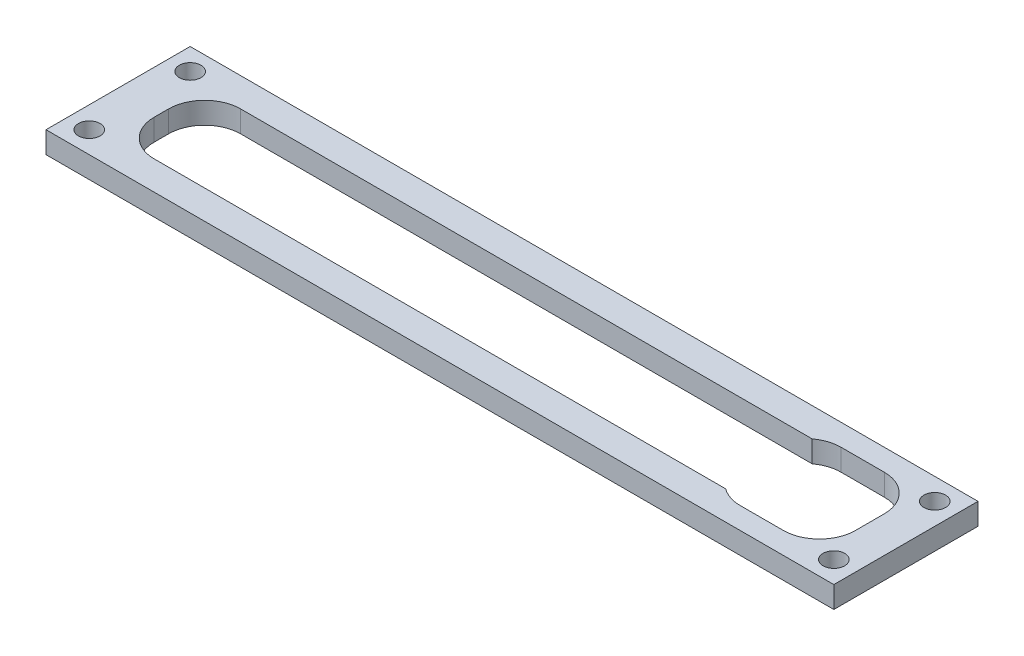
from build123d import *

# Parameters (mm, degrees)
SKETCH1_W           = 109.295835398
SKETCH1_H           = 20
SKETCH1_R           = 1.5
SKETCH1_W_2         = 97.295835398
SKETCH1_H_2         = 12
BOSS_EXTRUDE1_DEPTH = 3
CUT_EXTRUDE1_DEPTH  = 112.151156699
FILLET1_R           = 5


with BuildPart() as part:
    # Sketch1 → Boss-Extrude1 (new body)
    with BuildSketch(Plane(origin=(0, 0, 0), x_dir=(1, 0, 0), z_dir=(0, 1, 0))):
        with Locations((54.647917699, 10)):
            Rectangle(SKETCH1_W, SKETCH1_H)
        with Locations(Location((3, 17, 0), (0, 0, 270))):
            Circle(SKETCH1_R, mode=Mode.SUBTRACT)
        with Locations(Location((3, 3, 0), (0, 0, 90))):
            Circle(SKETCH1_R, mode=Mode.SUBTRACT)
        with Locations(Location((106.295835398, 3, 0), (0, 0, 270))):
            Circle(SKETCH1_R, mode=Mode.SUBTRACT)
        with Locations(Location((106.295835398, 17, 0), (0, 0, 90))):
            Circle(SKETCH1_R, mode=Mode.SUBTRACT)
        with Locations((54.647917699, 10)):
            Rectangle(SKETCH1_W_2, SKETCH1_H_2, mode=Mode.SUBTRACT)
    extrude(amount=BOSS_EXTRUDE1_DEPTH)

    # Sketch2 → Cut-Extrude1 (cut, through all)
    with BuildSketch(Plane(origin=(0, 3, 0), x_dir=(1, 0, 0), z_dir=(0, 1, 0))):
        Polygon((90.295835398, 17), (90.295835398, 16), (103.295835398, 16), (103.295835398, 4), (90.295835398, 4), (90.295835398, 3), (104.295835398, 3), (104.295835398, 17), align=None)
    extrude(amount=-CUT_EXTRUDE1_DEPTH, mode=Mode.SUBTRACT)

    # Fillet1
    # the kernel refuses this fillet: 5 mm, written as the material it adds along each edge
    with BuildSketch(Plane(origin=(104.295835398, 3, -17), x_dir=(0, 0, 1), z_dir=(0, -1, 0)), Plane(origin=(104.295835398, 3, -3), x_dir=(-1, 0, 0), z_dir=(0, -1, 0)), Plane(origin=(6, 0, -16), x_dir=(0, 0, 1), z_dir=(0, 1, 0))) as fillet1_piece_1:
        with BuildLine():
            CenterArc((FILLET1_R, FILLET1_R), FILLET1_R, 180, 90)
            Line((0, FILLET1_R), (-FILLET1_R * 0.02, FILLET1_R))
            Line((-FILLET1_R * 0.02, FILLET1_R), (-FILLET1_R * 0.02, -FILLET1_R * 0.02))
            Line((-FILLET1_R * 0.02, -FILLET1_R * 0.02), (FILLET1_R, -FILLET1_R * 0.02))
            Line((FILLET1_R, -FILLET1_R * 0.02), (FILLET1_R, 0))
        make_face()
    extrude(amount=3)
    with BuildSketch(Plane(origin=(90.295835398, 3, -17), x_dir=(1, 0, 0), z_dir=(0, -1, 0))) as fillet1_piece_2:
        with BuildLine():
            CenterArc((3, 5), FILLET1_R, 233.130102354, 36.869897646)
            Line((0, 1), (-0.06, 0.92))
            ThreePointArc((-0.06, 0.92), (-0.1, 0.5), (-0.1, 0))
            Line((-0.1, 0), (0, -0.1))
            Line((0, -0.1), (3, -0.1))
            Line((3, -0.1), (3, 0))
        make_face()
    extrude(amount=3)
    with BuildSketch(Plane(origin=(90.295835398, 3, -3), x_dir=(0, 0, -1), z_dir=(0, -1, 0))) as fillet1_piece_3:
        with BuildLine():
            CenterArc((5, 3), FILLET1_R, 180, 36.869897646)
            Line((0, 3), (-0.1, 3))
            Line((-0.1, 3), (-0.1, 0))
            Line((-0.1, 0), (0, -0.1))
            ThreePointArc((0, -0.1), (0.5, -0.1), (0.92, -0.06))
            Line((0.92, -0.06), (1, 0))
        make_face()
    extrude(amount=3)
    with BuildSketch(Plane(origin=(6, 0, -4), x_dir=(0, 0, -1), z_dir=(0, 1, 0))) as fillet1_piece_4:
        with BuildLine():
            CenterArc((FILLET1_R, -FILLET1_R), FILLET1_R, 90, 90)
            Line((0, -FILLET1_R), (-FILLET1_R * 0.02, -FILLET1_R))
            Line((-FILLET1_R * 0.02, -FILLET1_R), (-FILLET1_R * 0.02, FILLET1_R * 0.02))
            Line((-FILLET1_R * 0.02, FILLET1_R * 0.02), (FILLET1_R, FILLET1_R * 0.02))
            Line((FILLET1_R, FILLET1_R * 0.02), (FILLET1_R, 0))
        make_face()
    extrude(amount=3)


solid = part.part
